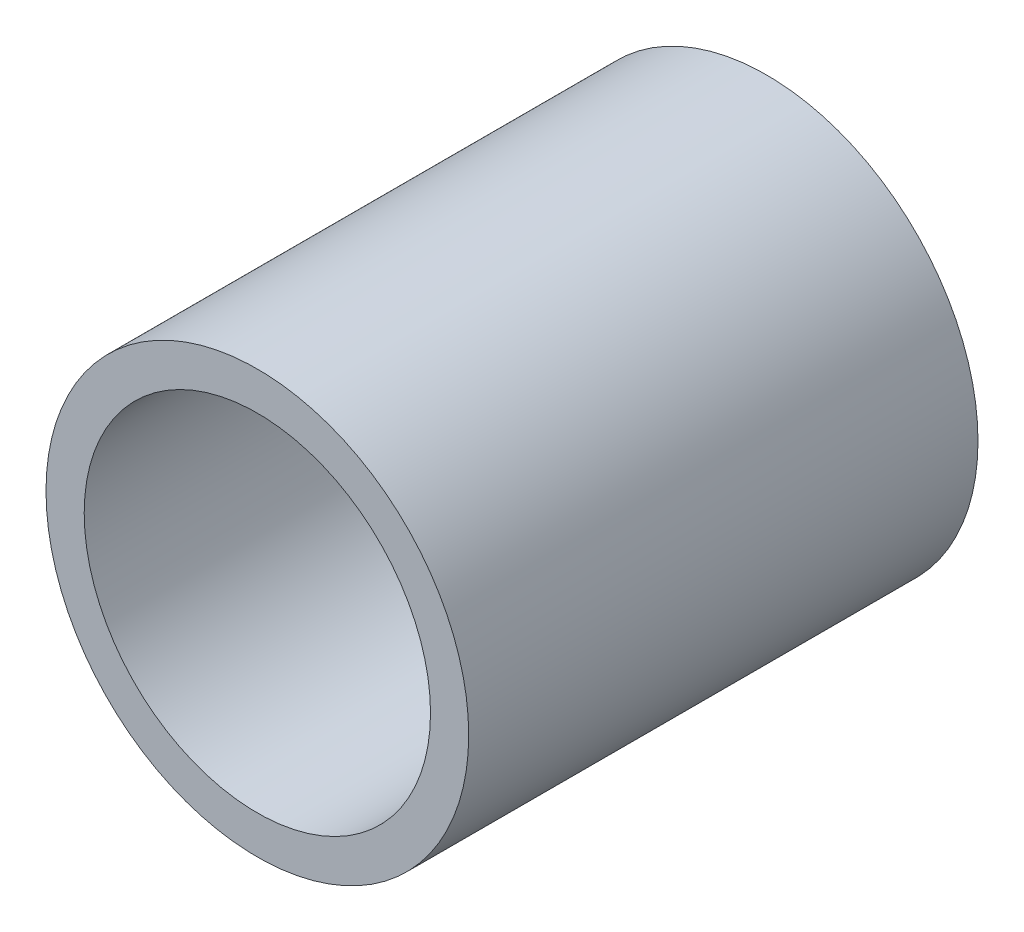
from build123d import *

# Parameters (mm, degrees)
SKETCH2_R           = 21.082
SKETCH2_R_2         = 17.272
BOSS_EXTRUDE1_DEPTH = 50.8


with BuildPart() as part:
    # Sketch2 → Boss-Extrude1 (new body)
    with BuildSketch(Plane.XY):
        Circle(SKETCH2_R)
        Circle(SKETCH2_R_2, mode=Mode.SUBTRACT)
    extrude(amount=BOSS_EXTRUDE1_DEPTH)


solid = part.part
